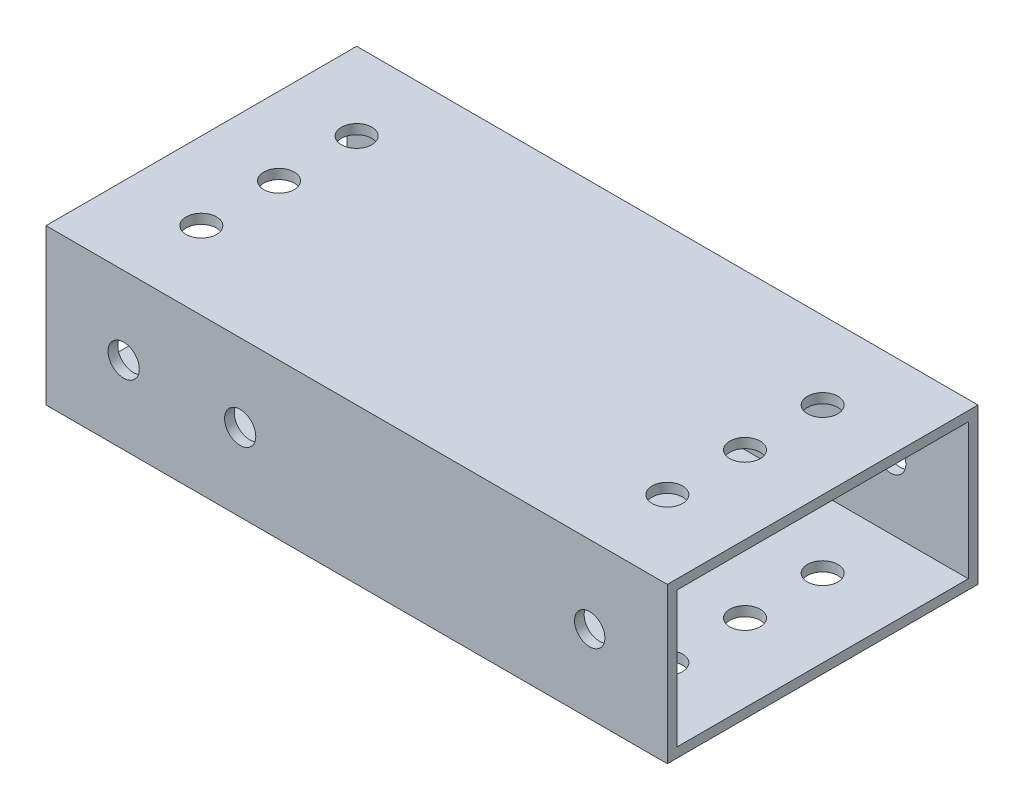
from build123d import *

# Parameters (mm, degrees)
SKETCH1_W           = 50.8
SKETCH1_H           = 25.4
BOSS_EXTRUDE1_DEPTH = 50.8
SHELL1_T            = -1.5875
SKETCH2_R           = 2.4892
CUT_EXTRUDE1_DEPTH  = 77.2
SKETCH3_R           = 2.4892
CUT_EXTRUDE2_DEPTH  = 77.2
SKETCH4_R           = 2.5527
CUT_EXTRUDE3_DEPTH  = 77.2
CUT_EXTRUDE4_REACH  = 78.2
SKETCH5_R           = 2.5527


with BuildPart() as part:
    # Sketch1 → Boss-Extrude1 (new, symmetric)
    with BuildSketch(Plane(origin=(0, 0, 0), x_dir=(0, 0, -1), z_dir=(1, 0, 0))):
        with Locations((25.4, 12.7)):
            Rectangle(SKETCH1_W, SKETCH1_H)
    extrude(amount=BOSS_EXTRUDE1_DEPTH, both=True)

    # Shell1
    shell1_openings = [part.faces().sort_by_distance(p)[0] for p in [
        (-50.8, 12.7, -25.4),
        (50.8, 12.7, -25.4),
    ]]
    offset(amount=SHELL1_T, openings=shell1_openings, kind=Kind.INTERSECTION)

    # Sketch2 → Cut-Extrude1 (cut, through all)
    with BuildSketch(Plane(origin=(0, 25.4, 0), x_dir=(1, 0, 0), z_dir=(0, 1, 0))):
        with Locations((-38.1, 25.4)):
            Circle(SKETCH2_R)
        with Locations((-38.1, 12.7)):
            Circle(SKETCH2_R)
        with Locations((-38.1, 38.1)):
            Circle(SKETCH2_R)
    cut_extrude1 = extrude(amount=-CUT_EXTRUDE1_DEPTH, mode=Mode.SUBTRACT)

    # Sketch3 → Cut-Extrude2 (cut, through all)
    with BuildSketch(Plane.XY):
        with Locations((-38.1, 12.7)):
            Circle(SKETCH3_R)
    cut_extrude2 = extrude(amount=-CUT_EXTRUDE2_DEPTH, mode=Mode.SUBTRACT)

    # Mirror1: Cut-Extrude1, Cut-Extrude2 across plane
    add(cut_extrude1.mirror(Plane(origin=(0, 0, 0), x_dir=(0, 0, 1), z_dir=(1, 0, 0))), mode=Mode.SUBTRACT)
    add(cut_extrude2.mirror(Plane(origin=(0, 0, 0), x_dir=(0, 0, 1), z_dir=(1, 0, 0))), mode=Mode.SUBTRACT)

    # Sketch4 → Cut-Extrude3 (cut, through all)
    with BuildSketch(Plane.XY):
        with Locations((-19.05, 12.7)):
            Circle(SKETCH4_R)
    extrude(amount=-CUT_EXTRUDE3_DEPTH, mode=Mode.SUBTRACT)

    # Sketch5 → Cut-Extrude4 (cut, up to next)
    with BuildSketch(Plane.XY, mode=Mode.PRIVATE) as cut_extrude4_sk1:
        with Locations((-38.1, 12.7)):
            Circle(SKETCH5_R)
    cut_extrude4_tool1 = extrude(cut_extrude4_sk1.sketch, amount=-CUT_EXTRUDE4_REACH, mode=Mode.PRIVATE) & part.part
    add(cut_extrude4_tool1.solids().sort_by_distance((-38.1, 12.7, 0))[0], mode=Mode.SUBTRACT)


solid = part.part
